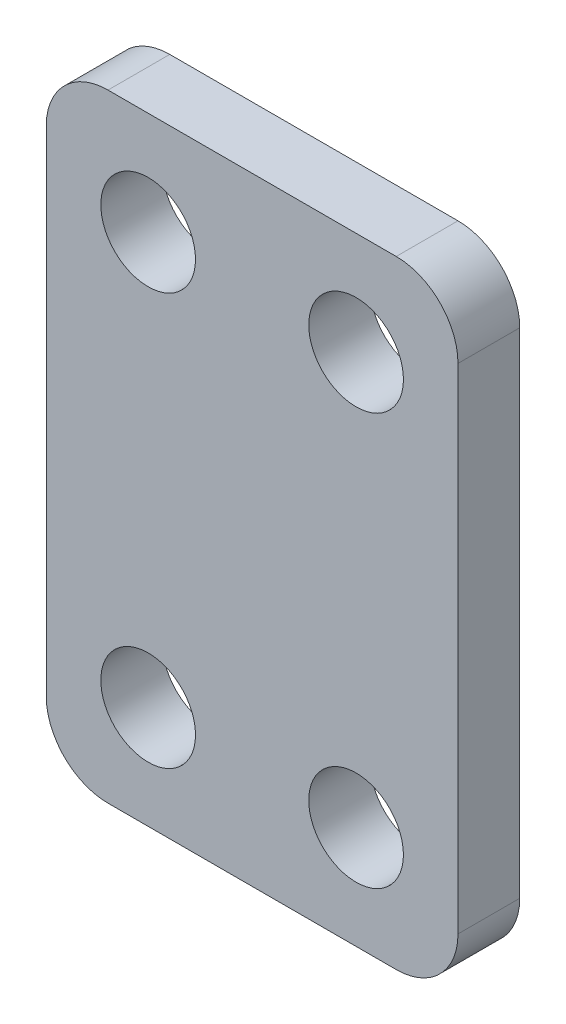
from build123d import *

# Parameters (mm, degrees)
SKETCH1_W           = 20
SKETCH1_H           = 30
BOSS_EXTRUDE1_DEPTH = 3
SKETCH2_R           = 2.3
CUT_EXTRUDE1_DEPTH  = 3
FILLET1_R           = 3


with BuildPart() as part:
    # Sketch1 → Boss-Extrude1 (new body)
    with BuildSketch(Plane.XY):
        Rectangle(SKETCH1_W, SKETCH1_H)
    extrude(amount=BOSS_EXTRUDE1_DEPTH)

    # Sketch2 → Cut-Extrude1 (cut)
    with BuildSketch(Plane.XY.offset(3)):
        with Locations((-5.05, 10)):
            Circle(SKETCH2_R)
        with Locations((5.05, 10)):
            Circle(SKETCH2_R)
        with Locations((-5.05, -10)):
            Circle(SKETCH2_R)
        with Locations((5.05, -10)):
            Circle(SKETCH2_R)
    extrude(amount=-CUT_EXTRUDE1_DEPTH, mode=Mode.SUBTRACT)

    # Fillet1
    fillet1_edges = [part.edges().sort_by_distance(p)[0] for p in [
        (-10, -15, 1.5),
        (10, -15, 1.5),
        (10, 15, 1.5),
        (-10, 15, 1.5),
    ]]
    fillet(fillet1_edges, radius=FILLET1_R)


solid = part.part
